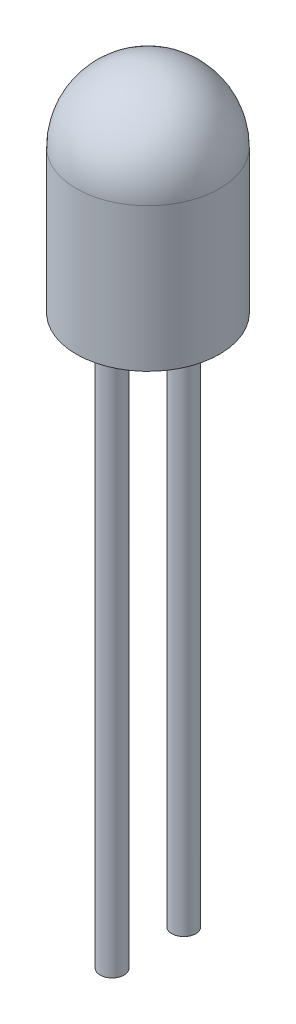
from build123d import *

# Parameters (mm, degrees)
SKETCH1_R           = 1.5
BOSS_EXTRUDE1_DEPTH = 3
SKETCH2_R           = 0.25
BOSS_EXTRUDE2_DEPTH = 11.5


# Read off the part's stored shape, not the designer's step: Dome1
with BuildPart() as part:
    # Sketch1 → Boss-Extrude1 (new body)
    with BuildSketch(Plane(origin=(0, 0, 0), x_dir=(1, 0, 0), z_dir=(0, 1, 0))):
        with Locations(Location((0, 0, 0), (0, 0, 270))):
            Circle(SKETCH1_R)
    extrude(amount=BOSS_EXTRUDE1_DEPTH)

    # Dome1 outline → Dome1 (revolve)
    with BuildSketch(Plane.XY):
        with BuildLine():
            Line((0, 3), (1.5, 2.999999998))
            ThreePointArc((1.5, 2.999999998), (1.060660172, 4.060660171), (0, 4.5))
            Line((0, 4.5), (0, 3))
        make_face()
    revolve(axis=Axis((0, 0, 0), (0, 1, 0)))

    # Sketch2 → Boss-Extrude2 (add)
    with BuildSketch(Plane.XZ):
        with Locations(Location((0, 0.75, 0), (0, 0, 90))):
            Circle(SKETCH2_R)
        with Locations(Location((0, -0.75, 0), (0, 0, 90))):
            Circle(SKETCH2_R)
    extrude(amount=BOSS_EXTRUDE2_DEPTH)


solid = part.part
